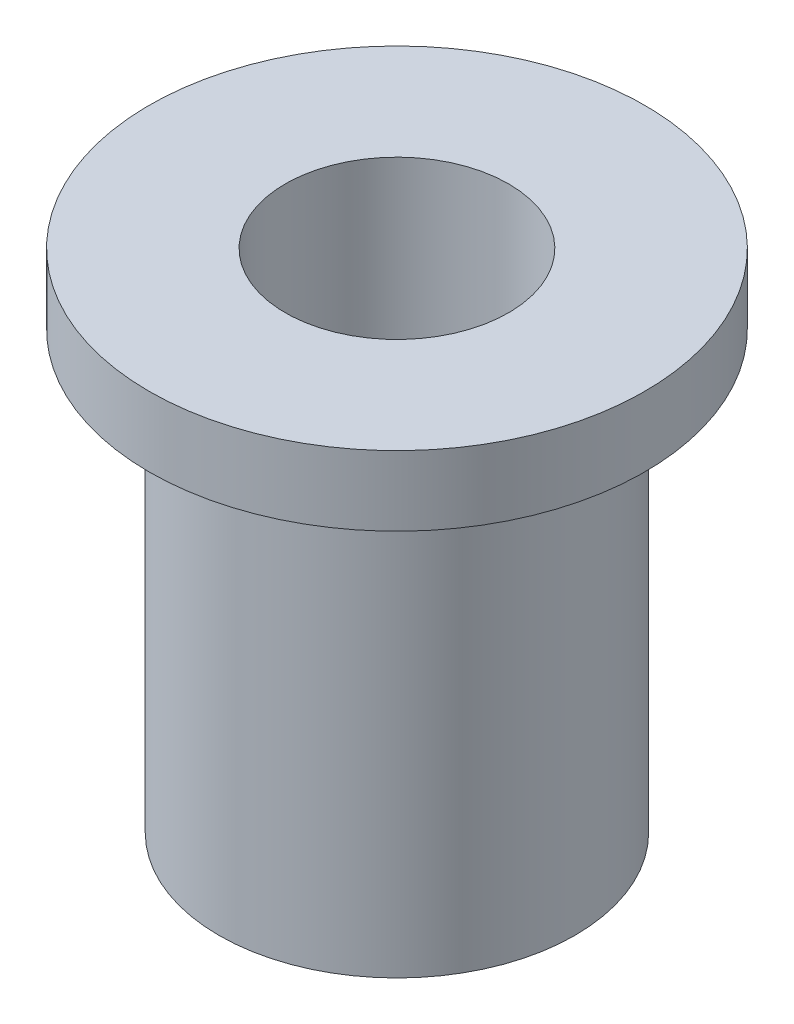
from build123d import *

# Parameters (mm, degrees)
SKETCH1_R           = 2.55
SKETCH1_R_2         = 1.6
BOSS_EXTRUDE1_DEPTH = 7.25
BOSS_EXTRUDE2_START = -1
SKETCH2_R           = 3.55
SKETCH2_R_2         = 1.6
BOSS_EXTRUDE2_DEPTH = 1


with BuildPart() as part:
    # Sketch1 → Boss-Extrude1 (new body)
    with BuildSketch(Plane(origin=(0, 0, 0), x_dir=(1, 0, 0), z_dir=(0, 1, 0))):
        Circle(SKETCH1_R)
        Circle(SKETCH1_R_2, mode=Mode.SUBTRACT)
    extrude(amount=BOSS_EXTRUDE1_DEPTH)

    # Sketch2 → Boss-Extrude2 (add)
    with BuildSketch(Plane(origin=(0, 7.25, 0), x_dir=(1, 0, 0), z_dir=(0, 1, 0)).offset(BOSS_EXTRUDE2_START)):
        Circle(SKETCH2_R)
        Circle(SKETCH2_R_2, mode=Mode.SUBTRACT)
    extrude(amount=BOSS_EXTRUDE2_DEPTH)


solid = part.part
